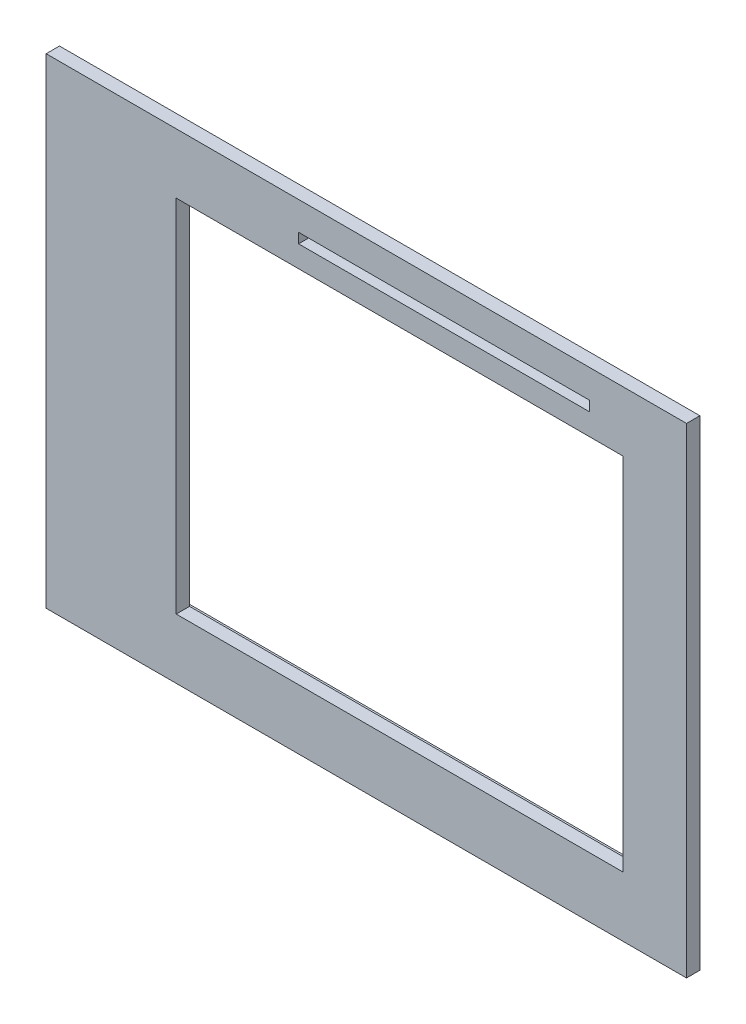
from build123d import *

# Parameters (mm, degrees)
SKETCH1_W                    = 96
SKETCH1_H                    = 72
SKETCH1_W_2                  = 67
SKETCH1_H_2                  = 54
BOSS_EXTRUDE1_DEPTH          = 2
CUT_EXTRUDE_THIN1_DEPTH      = 92.189559724
CUT_EXTRUDE_THIN1_DEPTH_BACK = 92.189559724
SKETCH3_W                    = 43.646431205
SKETCH3_H                    = 1.5
SKETCH2_W                    = 78.507135905
SKETCH2_H                    = 59.466414937
SKETCH2_W_2                  = 76.507135905
SKETCH2_H_2                  = 57.466414937
EXTRUDE_THIN3_DEPTH          = 2


with BuildPart() as part:
    # Sketch1 → Boss-Extrude1 (new body)
    with BuildSketch(Plane.XY):
        with Locations((29.079590885, 12.685444145)):
            Rectangle(SKETCH1_W, SKETCH1_H)
        with Locations((34.079590885, 12.685444145)):
            Rectangle(SKETCH1_W_2, SKETCH1_H_2, mode=Mode.SUBTRACT)
    extrude(amount=BOSS_EXTRUDE1_DEPTH)

    # Sketch3 → Cut-Extrude-Thin1 (cut, two sides: drawn at the far end of the back side and taken through both)
    with BuildSketch(Plane.XY.offset(2).offset(-CUT_EXTRUDE_THIN1_DEPTH_BACK)):
        with Locations((40.74608442, 43.673328731)):
            Rectangle(SKETCH3_W, SKETCH3_H)
    extrude(amount=CUT_EXTRUDE_THIN1_DEPTH + CUT_EXTRUDE_THIN1_DEPTH_BACK, mode=Mode.SUBTRACT)

    # Sketch2 → Extrude-Thin3 (add)
    with BuildSketch(Plane(origin=(0, 0, 0), x_dir=(-1, 0, 0), z_dir=(0, 0, -1))):
        with Locations((-34.079590886, 12.685444146)):
            Rectangle(SKETCH2_W, SKETCH2_H)
        with Locations((-34.079590886, 12.685444146)):
            Rectangle(SKETCH2_W_2, SKETCH2_H_2, mode=Mode.SUBTRACT)
    extrude(amount=EXTRUDE_THIN3_DEPTH)


solid = part.part
